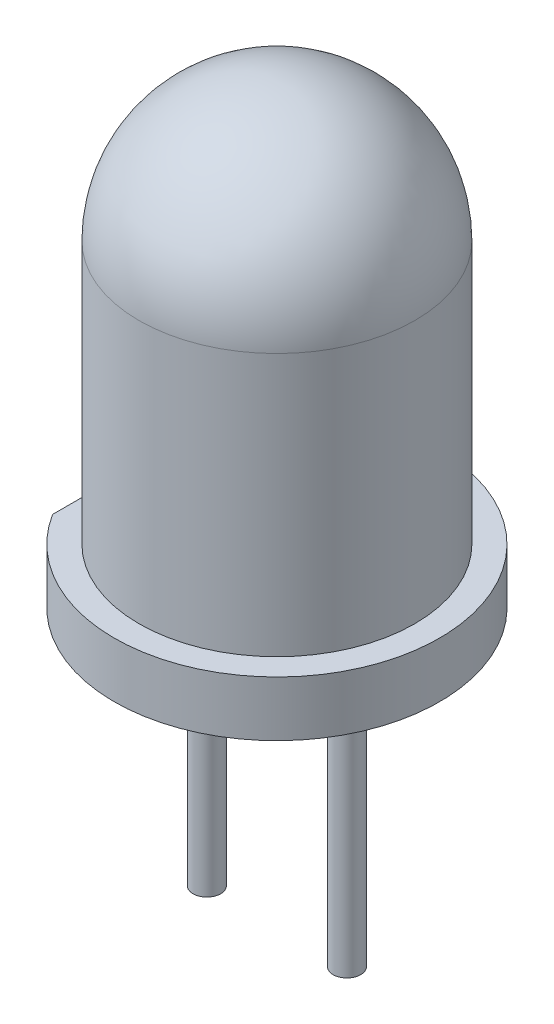
from build123d import *

# Parameters (mm, degrees)
SKETCH1_R           = 2.95
BOSS_EXTRUDE1_DEPTH = 1
SKETCH2_R           = 2.5
BOSS_EXTRUDE2_DEPTH = 4.76
CUT_EXTRUDE1_DEPTH  = 7.32950235
SKETCH5_R           = 0.25
BOSS_EXTRUDE3_DEPTH = 5


with BuildPart() as part:
    # Sketch1 → Boss-Extrude1 (new body)
    with BuildSketch(Plane(origin=(0, 0, 0), x_dir=(1, 0, 0), z_dir=(0, 1, 0))):
        Circle(SKETCH1_R)
    extrude(amount=BOSS_EXTRUDE1_DEPTH)

    # Sketch2 → Boss-Extrude2 (add)
    with BuildSketch(Plane(origin=(0, 1, 0), x_dir=(1, 0, 0), z_dir=(0, 1, 0))):
        Circle(SKETCH2_R)
    extrude(amount=BOSS_EXTRUDE2_DEPTH)

    # Sketch3 → Cut-Extrude1 (cut, through all)
    with BuildSketch(Plane(origin=(0, 1, 0), x_dir=(1, 0, 0), z_dir=(0, 1, 0))):
        with BuildLine():
            Line((-2.5, 1.566045976), (-2.5, -1.566045976))
            ThreePointArc((-2.5, -1.566045976), (-2.95, 0), (-2.5, 1.566045976))
        make_face()
    extrude(amount=-CUT_EXTRUDE1_DEPTH, mode=Mode.SUBTRACT)

    # Sketch4 → Revolve1 (revolve)
    with BuildSketch(Plane.XZ.offset(-5.76)):
        with BuildLine():
            Line((0, -2.5), (0, 2.5))
            ThreePointArc((0, 2.5), (2.5, 0), (0, -2.5))
        make_face()
    revolve(axis=Axis((0, 5.76, -2.5), (0, 0, 1)))

    # Sketch5 → Boss-Extrude3 (add)
    with BuildSketch(Plane.XZ):
        with Locations((1.27, 0)):
            Circle(SKETCH5_R)
        with Locations((-1.27, 0)):
            Circle(SKETCH5_R)
    extrude(amount=BOSS_EXTRUDE3_DEPTH)


solid = part.part
